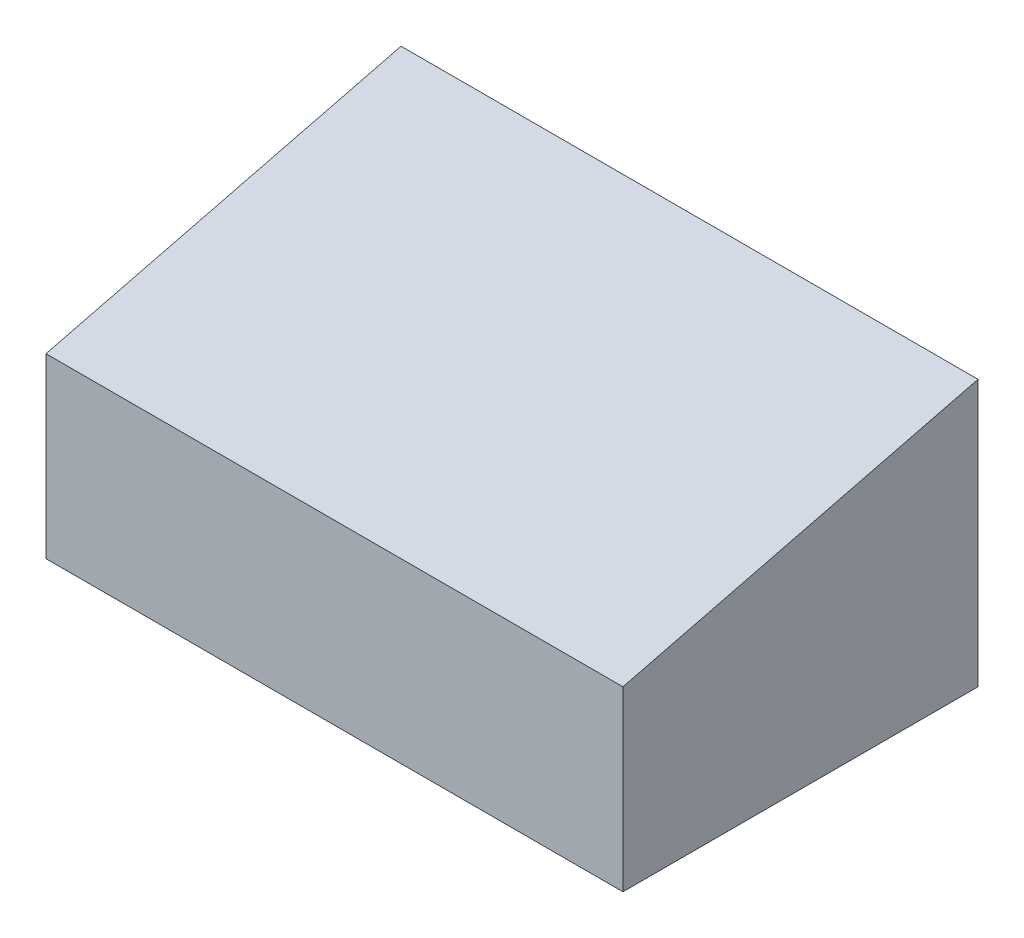
from build123d import *

# Parameters (mm, degrees)
SKETCH1_W           = 130
SKETCH1_H           = 80
BOSS_EXTRUDE1_DEPTH = 60
CHAMFER1_SIZE2      = 80
CHAMFER1_SIZE       = 20


with BuildPart() as part:
    # Sketch1 → Boss-Extrude1 (new body)
    with BuildSketch(Plane(origin=(0, 0, 0), x_dir=(1, 0, 0), z_dir=(0, 1, 0))):
        Rectangle(SKETCH1_W, SKETCH1_H)
    extrude(amount=BOSS_EXTRUDE1_DEPTH)

    # Chamfer1
    chamfer1_edges = [part.edges().sort_by_distance(p)[0] for p in [
        (0, 60, 40),
    ]]
    chamfer1_side = [part.faces().sort_by_distance(p)[0] for p in [
        (0, 59.6, 40),
    ]]
    chamfer(chamfer1_edges, length=CHAMFER1_SIZE - 0.0001, length2=CHAMFER1_SIZE2 - 0.0001, reference=chamfer1_side[0])  # a hair under: the kernel refuses the full size


solid = part.part
